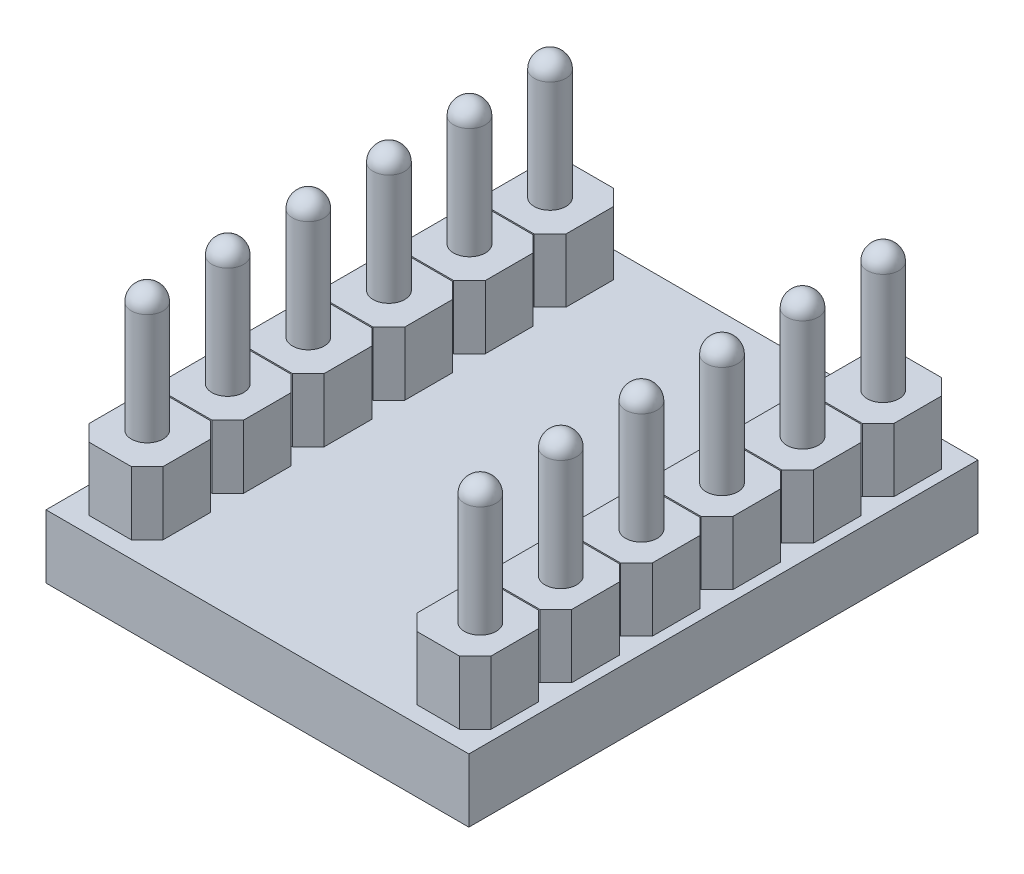
from build123d import *

# Parameters (mm, degrees)
SKETCH1_W                  = 13.33
SKETCH1_H                  = 16.05
BOSS_EXTRUDE1_DEPTH        = 2
SKETCH2_W                  = 2.341712188
SKETCH2_H                  = 2.5
BOSS_EXTRUDE2_DEPTH        = 2
CHAMFER1_SIZE              = 0.5
SKETCH3_R                  = 0.5
BOSS_EXTRUDE3_DEPTH        = 4
FILLET1_R                  = 0.5
LPATTERN1_COUNT            = 6
LPATTERN1_PITCH            = 2.54
CHAMFER1_OF_LPATTERN1_SIZE = 0.5
FILLET1_OF_LPATTERN1_R     = 0.5


# Read off the part's stored shape, not the designer's step: Mirror1
with BuildPart() as part:
    # Sketch1 → Boss-Extrude1 (new body)
    with BuildSketch(Plane(origin=(0, 0, 0), x_dir=(1, 0, 0), z_dir=(0, 1, 0))):
        Rectangle(SKETCH1_W, SKETCH1_H)
    extrude(amount=BOSS_EXTRUDE1_DEPTH)

    # Sketch2 → Boss-Extrude2 (add)
    with BuildSketch(Plane(origin=(0, 2, 0), x_dir=(1, 0, 0), z_dir=(0, 1, 0))):
        with Locations((-5.170856094, -6.25)):
            Rectangle(SKETCH2_W, SKETCH2_H)
    boss_extrude2 = extrude(amount=BOSS_EXTRUDE2_DEPTH)

    # Chamfer1
    chamfer1_edges = [part.edges().sort_by_distance(p)[0] for p in [
        (-6.341712188, 3, 5),
        (-6.341712188, 3, 7.5),
        (-4, 3, 7.5),
        (-4, 3, 5),
    ]]
    chamfer(chamfer1_edges, length=CHAMFER1_SIZE)

    # Sketch3 → Boss-Extrude3 (add)
    with BuildSketch(Plane(origin=(0, 4, 0), x_dir=(1, 0, 0), z_dir=(0, 1, 0))):
        with Locations(Location((-5.25, -6.25, 0), (0, 0, 270))):
            Circle(SKETCH3_R)
    boss_extrude3 = extrude(amount=BOSS_EXTRUDE3_DEPTH)

    # Fillet1
    fillet1_edges = [part.edges().sort_by_distance(p)[0] for p in [
        (-5.25, 8, 5.75),
    ]]
    fillet(fillet1_edges, radius=FILLET1_R)

    # LPattern1: Boss-Extrude2, Boss-Extrude3 ×6
    with Locations(*[(0, 0, -i * LPATTERN1_PITCH) for i in range(1, LPATTERN1_COUNT)]):
        add(boss_extrude2)
        add(boss_extrude3)

    # Chamfer1 of LPattern1
    chamfer1_of_lpattern1_edges = [part.edges().sort_by_distance(p)[0] for p in [
        (-6.341712188, 3, 2.46),
        (-6.341712188, 3, 4.96),
        (-4, 3, 4.96),
        (-4, 3, 2.46),
        (-6.341712188, 3, -0.08),
        (-6.341712188, 3, 2.42),
        (-4, 3, 2.42),
        (-4, 3, -0.08),
        (-6.341712188, 3, -2.62),
        (-6.341712188, 3, -0.12),
        (-4, 3, -0.12),
        (-4, 3, -2.62),
        (-6.341712188, 3, -5.16),
        (-6.341712188, 3, -2.66),
        (-4, 3, -2.66),
        (-4, 3, -5.16),
        (-6.341712188, 3, -7.7),
        (-6.341712188, 3, -5.2),
        (-4, 3, -5.2),
        (-4, 3, -7.7),
    ]]
    chamfer(chamfer1_of_lpattern1_edges, length=CHAMFER1_OF_LPATTERN1_SIZE)

    # Fillet1 of LPattern1
    fillet1_of_lpattern1_edges = [part.edges().sort_by_distance(p)[0] for p in [
        (-5.25, 8, 3.21),
        (-5.25, 8, 0.67),
        (-5.25, 8, -1.87),
        (-5.25, 8, -4.41),
        (-5.25, 8, -6.95),
    ]]
    fillet(fillet1_of_lpattern1_edges, radius=FILLET1_OF_LPATTERN1_R)

    # Mirror1: part across plane


with BuildPart() as part_1:
    add(part.part)
    add(part.part.mirror(Plane(origin=(0, 0, 0), x_dir=(0, 0, 1), z_dir=(1, 0, 0))))


solid = part_1.part
